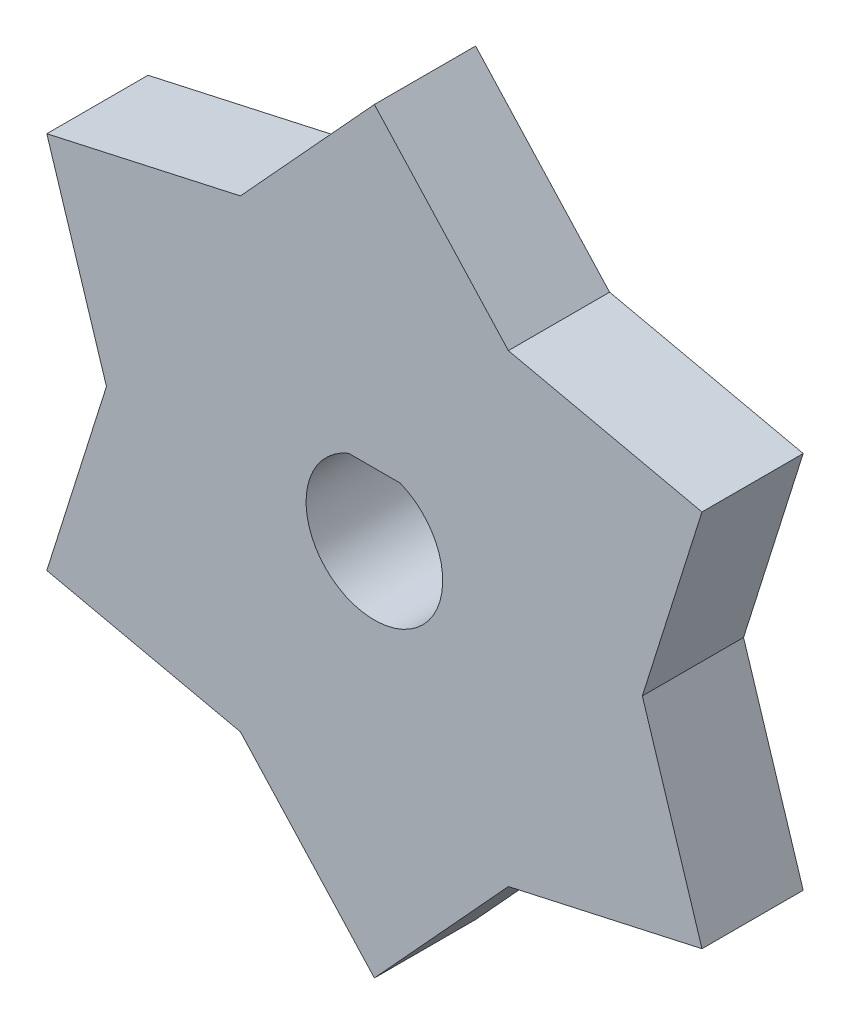
from build123d import *

# Parameters (mm, degrees)
BOSS_EXTRUDE1_DEPTH = 2
CUT_EXTRUDE1_DEPTH  = 11.088652962


with BuildPart() as part:
    # Sketch1 → Boss-Extrude1 (new body)
    with BuildSketch(Plane.XY):
        Polygon((2.647536041, 4.585666938), (0, 7.474945526), (-2.647536041, 4.585666938), (-6.473492718, 3.737472763), (-5.295072082, 0), (-6.473492718, -3.737472763), (-2.647536041, -4.585666938), (0, -7.474945526), (2.647536041, -4.585666938), (6.473492718, -3.737472763), (5.295072082, 0), (6.473492718, 3.737472763), align=None)
    extrude(amount=-BOSS_EXTRUDE1_DEPTH)

    # Sketch2 → Cut-Extrude1 (cut, through all)
    with BuildSketch(Plane.XY):
        with BuildLine():
            Line((0.509901951, 1.25), (-0.509901951, 1.25))
            ThreePointArc((-0.509901951, 1.25), (-1.12046143, 0.753037969), (-1.35, 0))
            ThreePointArc((-1.35, 0), (0, -1.35), (1.35, 0))
            ThreePointArc((1.35, 0), (1.12046143, 0.753037969), (0.509901951, 1.25))
        make_face()
    extrude(amount=-CUT_EXTRUDE1_DEPTH, mode=Mode.SUBTRACT)


solid = part.part
